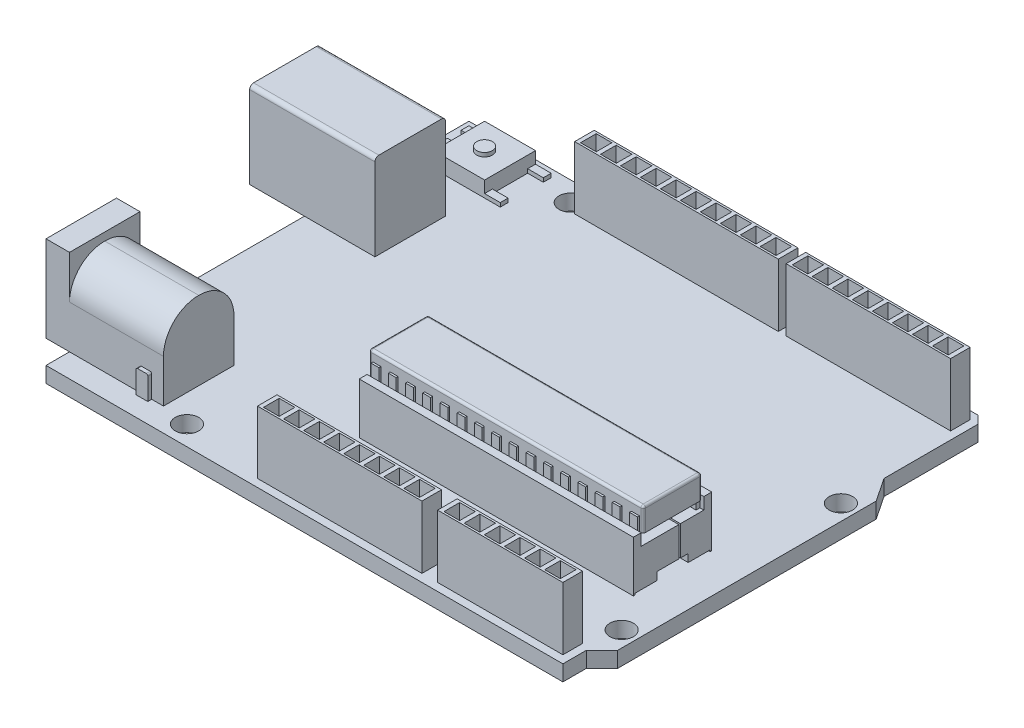
from build123d import *

# Parameters (mm, degrees)
IZIM2_R                           = 1.5
Y_KSEKLIK_EKSTR_ZYON1_DEPTH       = 2
IZIM3_W                           = 6.5
IZIM3_H                           = 6.5
Y_KSEKLIK_EKSTR_ZYON2_DEPTH       = 2
IZIM4_R                           = 1
Y_KSEKLIK_EKSTR_ZYON3_DEPTH       = 0.5
IZIM5_W                           = 2
IZIM5_H                           = 1
Y_KSEKLIK_EKSTR_ZYON4_DEPTH       = 0.5
IZIM6_W                           = 16
IZIM6_H                           = 9
Y_KSEKLIK_EKSTR_ZYON5_DEPTH       = 11
KES_EKSTR_ZYON1_DEPTH             = 11
IZIM8_W                           = 5.5
IZIM8_H                           = 3
Y_KSEKLIK_EKSTR_ZYON6_DEPTH       = 11
RADYUS1_R                         = 0.5
RADYUS2_R                         = 0.5
IZIM9_W                           = 12
IZIM9_H                           = 9
Y_KSEKLIK_EKSTR_ZYON7_DEPTH       = 10
RADYUS3_R                         = 4.5
RADYUS4_R                         = 4.5
IZIM10_W                          = 9
IZIM10_H                          = 11
Y_KSEKLIK_EKSTR_ZYON8_DEPTH       = 3
IZIM11_R                          = 3
KES_EKSTR_ZYON2_DEPTH             = 8
IZIM12_R                          = 0.5
Y_KSEKLIK_EKSTR_ZYON9_DEPTH       = 7
IZIM13_W                          = 1.5
IZIM13_H                          = 3
Y_KSEKLIK_EKSTR_ZYON10_DEPTH      = 0.5
RADYUS5_R                         = 0.2
RADYUS6_R                         = 0.2
IZIM15_W                          = 1.5
IZIM15_H                          = 3
Y_KSEKLIK_EKSTR_ZYON11_DEPTH      = 0.5
RADYUS7_R                         = 0.2
RADYUS8_R                         = 0.2
RADYUS9_R                         = 0.3
IZIM16_W                          = 35
IZIM16_H                          = 10
Y_KSEKLIK_EKSTR_ZYON12_DEPTH      = 5
IZIM17_W                          = 35
IZIM17_H                          = 1
Y_KSEKLIK_EKSTR_ZYON13_DEPTH      = 1.5
IZIM18_W                          = 1
IZIM18_H                          = 0.5
Y_KSEKLIK_EKSTR_ZYON14_DEPTH      = 3
Y_KSEKLIK_EKSTR_ZYON15_DEPTH      = 2.5
Y_KSEKLIK_EKSTR_ZYON15_DEPTH_BACK = 0.5
IZIM19_W                          = 35
IZIM19_H                          = 7.5
RADYUS10_R                        = 0.3
RADYUS11_R                        = 0.3
RADYUS12_R                        = 0.3
RADYUS13_R                        = 0.3
KES_EKSTR_ZYON3_REACH             = 78.145
IZIM21_W                          = 16
IZIM21_H                          = 2.5
IZIM21_W_2                        = 2
IZIM21_H_2                        = 2
IZIM21_W_3                        = 21
Y_KSEKLIK_EKSTR_ZYON16_DEPTH      = 8
IZIM22_W                          = 21
IZIM22_H                          = 2.5
IZIM22_W_2                        = 2
IZIM22_H_2                        = 2
IZIM22_W_3                        = 26
Y_KSEKLIK_EKSTR_ZYON17_DEPTH      = 8


with BuildPart() as part:
    # Çizim2 → Yükseklik-Ekstrüzyon1 (new body)
    with BuildSketch(Plane(origin=(0, 0, 0), x_dir=(1, 0, 0), z_dir=(0, 1, 0))):
        Polygon((-34, 27), (31, 27), (32, 26), (32, 14), (34, 11), (34, -22), (32, -24), (32, -27), (-34, -27), align=None)
        with Locations(Location((32, -19.5, 0), (0, 0, 270))):
            Circle(IZIM2_R, mode=Mode.SUBTRACT)
        with Locations(Location((32, 8.5, 0), (0, 0, 270))):
            Circle(IZIM2_R, mode=Mode.SUBTRACT)
        with Locations(Location((-18.5, 24.5, 0), (0, 0, 270))):
            Circle(IZIM2_R, mode=Mode.SUBTRACT)
        with Locations(Location((-18.5, -24.5, 0), (0, 0, 270))):
            Circle(IZIM2_R, mode=Mode.SUBTRACT)
    extrude(amount=Y_KSEKLIK_EKSTR_ZYON1_DEPTH)

    # Çizim3 → Yükseklik-Ekstrüzyon2 (add)
    with BuildSketch(Plane(origin=(0, 2, 0), x_dir=(1, 0, 0), z_dir=(0, 1, 0))):
        with Locations((-27.75, 22.75)):
            Rectangle(IZIM3_W, IZIM3_H)
    extrude(amount=Y_KSEKLIK_EKSTR_ZYON2_DEPTH)

    # Çizim4 → Yükseklik-Ekstrüzyon3 (add)
    with BuildSketch(Plane(origin=(0, 4, 0), x_dir=(1, 0, 0), z_dir=(0, 1, 0))):
        with Locations(Location((-27.75, 22.75, 0), (0, 0, 270))):
            Circle(IZIM4_R)
    extrude(amount=Y_KSEKLIK_EKSTR_ZYON3_DEPTH)

    # Çizim5 → Yükseklik-Ekstrüzyon4 (add)
    with BuildSketch(Plane(origin=(0, 2, 0), x_dir=(1, 0, 0), z_dir=(0, 1, 0))):
        with Locations((-32, 22.75)):
            Rectangle(IZIM5_W, IZIM5_H)
        with Locations((-32, 25.5)):
            Rectangle(IZIM5_W, IZIM5_H)
        with Locations((-32, 20)):
            Rectangle(IZIM5_W, IZIM5_H)
        with Locations((-23.5, 25.5)):
            Rectangle(IZIM5_W, IZIM5_H)
        with Locations((-23.5, 20)):
            Rectangle(IZIM5_W, IZIM5_H)
    extrude(amount=Y_KSEKLIK_EKSTR_ZYON4_DEPTH)

    # Çizim6 → Yükseklik-Ekstrüzyon5 (add)
    with BuildSketch(Plane(origin=(0, 2, 0), x_dir=(1, 0, 0), z_dir=(0, 1, 0))):
        with Locations((-33, 10.5)):
            Rectangle(IZIM6_W, IZIM6_H)
    extrude(amount=Y_KSEKLIK_EKSTR_ZYON5_DEPTH)

    # Çizim7 → Kes-Ekstrüzyon1 (cut)
    with BuildSketch(Plane.ZY.offset(41)):
        Polygon((-14, 3.5), (-7, 3.5), (-7, 10.5), (-8.5, 12), (-12.5, 12), (-14, 10.5), align=None)
    extrude(amount=-KES_EKSTR_ZYON1_DEPTH, mode=Mode.SUBTRACT)

    # Çizim8 → Yükseklik-Ekstrüzyon6 (add)
    with BuildSketch(Plane.ZY.offset(30)):
        with Locations((-10.5, 7)):
            Rectangle(IZIM8_W, IZIM8_H)
    extrude(amount=Y_KSEKLIK_EKSTR_ZYON6_DEPTH)

    # Radyus1
    radyus1_edges = [part.edges().sort_by_distance(p)[0] for p in [
        (-33, 13, -6),
    ]]
    fillet(radyus1_edges, radius=RADYUS1_R)

    # Radyus2
    radyus2_edges = [part.edges().sort_by_distance(p)[0] for p in [
        (-33, 13, -15),
    ]]
    fillet(radyus2_edges, radius=RADYUS2_R)

    # Çizim9 → Yükseklik-Ekstrüzyon7 (add)
    with BuildSketch(Plane(origin=(0, 2, 0), x_dir=(1, 0, 0), z_dir=(0, 1, 0))):
        with Locations((-28, -19.5)):
            Rectangle(IZIM9_W, IZIM9_H)
    extrude(amount=Y_KSEKLIK_EKSTR_ZYON7_DEPTH)

    # Radyus3
    radyus3_edges = [part.edges().sort_by_distance(p)[0] for p in [
        (-28, 12, 15),
    ]]
    fillet(radyus3_edges, radius=RADYUS3_R)

    # Radyus4
    radyus4_edges = [part.edges().sort_by_distance(p)[0] for p in [
        (-28, 12, 24),
    ]]
    fillet(radyus4_edges, radius=RADYUS4_R - 0.0001)  # a hair under: the kernel refuses the full size

    # Çizim10 → Yükseklik-Ekstrüzyon8 (add)
    with BuildSketch(Plane.ZY.offset(34)):
        with Locations((19.5, 7.5)):
            Rectangle(IZIM10_W, IZIM10_H)
    extrude(amount=Y_KSEKLIK_EKSTR_ZYON8_DEPTH)

    # Çizim11 → Kes-Ekstrüzyon2 (cut)
    with BuildSketch(Plane.ZY.offset(37)):
        with Locations((19.5, 8)):
            Circle(IZIM11_R)
    extrude(amount=-KES_EKSTR_ZYON2_DEPTH, mode=Mode.SUBTRACT)

    # Çizim12 → Yükseklik-Ekstrüzyon9 (add)
    with BuildSketch(Plane.ZY.offset(29)):
        with Locations((19.5, 8)):
            Circle(IZIM12_R)
    extrude(amount=Y_KSEKLIK_EKSTR_ZYON9_DEPTH)

    # Çizim13 → Yükseklik-Ekstrüzyon10 (add)
    with BuildSketch(Plane.XY.offset(24)):
        with Locations((-24.25, 3.5)):
            Rectangle(IZIM13_W, IZIM13_H)
    extrude(amount=Y_KSEKLIK_EKSTR_ZYON10_DEPTH)

    # Radyus5
    radyus5_edges = [part.edges().sort_by_distance(p)[0] for p in [
        (-23.5, 5, 24.25),
    ]]
    fillet(radyus5_edges, radius=RADYUS5_R)

    # Radyus6
    radyus6_edges = [part.edges().sort_by_distance(p)[0] for p in [
        (-25, 5, 24.25),
    ]]
    fillet(radyus6_edges, radius=RADYUS6_R)

    # Çizim15 → Yükseklik-Ekstrüzyon11 (add)
    with BuildSketch(Plane(origin=(0, 0, 15), x_dir=(-1, 0, 0), z_dir=(0, 0, -1))):
        with Locations((24.25, 3.5)):
            Rectangle(IZIM15_W, IZIM15_H)
    extrude(amount=Y_KSEKLIK_EKSTR_ZYON11_DEPTH)

    # Radyus7
    radyus7_edges = [part.edges().sort_by_distance(p)[0] for p in [
        (-23.5, 5, 14.75),
    ]]
    fillet(radyus7_edges, radius=RADYUS7_R)

    # Radyus8
    radyus8_edges = [part.edges().sort_by_distance(p)[0] for p in [
        (-25, 5, 14.75),
    ]]
    fillet(radyus8_edges, radius=RADYUS8_R)

    # Radyus9
    radyus9_edges = [part.edges().sort_by_distance(p)[0] for p in [
        (-36, 8, 19),
    ]]
    fillet(radyus9_edges, radius=RADYUS9_R)

    # Çizim16 → Yükseklik-Ekstrüzyon12 (add)
    with BuildSketch(Plane(origin=(0, 2, 0), x_dir=(1, 0, 0), z_dir=(0, 1, 0))):
        with Locations((11.5, -10)):
            Rectangle(IZIM16_W, IZIM16_H)
    extrude(amount=Y_KSEKLIK_EKSTR_ZYON12_DEPTH)

    # Çizim17 → Yükseklik-Ekstrüzyon13 (add)
    with BuildSketch(Plane(origin=(0, 7, 0), x_dir=(1, 0, 0), z_dir=(0, 1, 0))):
        with Locations((11.5, -5.5)):
            Rectangle(IZIM17_W, IZIM17_H)
        with Locations((11.5, -14.5)):
            Rectangle(IZIM17_W, IZIM17_H)
    extrude(amount=Y_KSEKLIK_EKSTR_ZYON13_DEPTH)

    # Çizim18 → Yükseklik-Ekstrüzyon14 (add)
    with BuildSketch(Plane(origin=(0, 7, 0), x_dir=(1, 0, 0), z_dir=(0, 1, 0))):
        with Locations((-5, -6.25)):
            Rectangle(IZIM18_W, IZIM18_H)
        with Locations((-2.8, -6.25)):
            Rectangle(IZIM18_W, IZIM18_H)
        with Locations((-0.6, -6.25)):
            Rectangle(IZIM18_W, IZIM18_H)
        with Locations((1.6, -6.25)):
            Rectangle(IZIM18_W, IZIM18_H)
        with Locations((3.8, -6.25)):
            Rectangle(IZIM18_W, IZIM18_H)
        with Locations((6, -6.25)):
            Rectangle(IZIM18_W, IZIM18_H)
        with Locations((8.2, -6.25)):
            Rectangle(IZIM18_W, IZIM18_H)
        with Locations((10.4, -6.25)):
            Rectangle(IZIM18_W, IZIM18_H)
        with Locations((12.6, -6.25)):
            Rectangle(IZIM18_W, IZIM18_H)
        with Locations((14.8, -6.25)):
            Rectangle(IZIM18_W, IZIM18_H)
        with Locations((17, -6.25)):
            Rectangle(IZIM18_W, IZIM18_H)
        with Locations((19.2, -6.25)):
            Rectangle(IZIM18_W, IZIM18_H)
        with Locations((21.4, -6.25)):
            Rectangle(IZIM18_W, IZIM18_H)
        with Locations((23.6, -6.25)):
            Rectangle(IZIM18_W, IZIM18_H)
        with Locations((25.8, -6.25)):
            Rectangle(IZIM18_W, IZIM18_H)
        with Locations((28, -6.25)):
            Rectangle(IZIM18_W, IZIM18_H)
        with Locations((28, -13.75)):
            Rectangle(IZIM18_W, IZIM18_H)
        with Locations((25.8, -13.75)):
            Rectangle(IZIM18_W, IZIM18_H)
        with Locations((23.6, -13.75)):
            Rectangle(IZIM18_W, IZIM18_H)
        with Locations((21.4, -13.75)):
            Rectangle(IZIM18_W, IZIM18_H)
        with Locations((19.2, -13.75)):
            Rectangle(IZIM18_W, IZIM18_H)
        with Locations((17, -13.75)):
            Rectangle(IZIM18_W, IZIM18_H)
        with Locations((14.8, -13.75)):
            Rectangle(IZIM18_W, IZIM18_H)
        with Locations((12.6, -13.75)):
            Rectangle(IZIM18_W, IZIM18_H)
        with Locations((10.4, -13.75)):
            Rectangle(IZIM18_W, IZIM18_H)
        with Locations((8.2, -13.75)):
            Rectangle(IZIM18_W, IZIM18_H)
        with Locations((6, -13.75)):
            Rectangle(IZIM18_W, IZIM18_H)
        with Locations((3.8, -13.75)):
            Rectangle(IZIM18_W, IZIM18_H)
        with Locations((1.6, -13.75)):
            Rectangle(IZIM18_W, IZIM18_H)
        with Locations((-0.6, -13.75)):
            Rectangle(IZIM18_W, IZIM18_H)
        with Locations((-2.8, -13.75)):
            Rectangle(IZIM18_W, IZIM18_H)
        with Locations((-5, -13.75)):
            Rectangle(IZIM18_W, IZIM18_H)
    extrude(amount=Y_KSEKLIK_EKSTR_ZYON14_DEPTH)

    # Çizim19 → Yükseklik-Ekstrüzyon15 (add, two sides: drawn at the far end of the back side and taken through both)
    with BuildSketch(Plane(origin=(0, 8.75, 0), x_dir=(1, 0, 0), z_dir=(0, 1, 0)).offset(-Y_KSEKLIK_EKSTR_ZYON15_DEPTH_BACK)):
        with Locations((11.5, -10)):
            Rectangle(IZIM19_W, IZIM19_H)
    extrude(amount=Y_KSEKLIK_EKSTR_ZYON15_DEPTH + Y_KSEKLIK_EKSTR_ZYON15_DEPTH_BACK)

    # Radyus10
    radyus10_edges = [part.edges().sort_by_distance(p)[0] for p in [
        (11.5, 11.25, 13.75),
    ]]
    fillet(radyus10_edges, radius=RADYUS10_R)

    # Radyus11
    radyus11_edges = [part.edges().sort_by_distance(p)[0] for p in [
        (11.5, 11.25, 6.25),
    ]]
    fillet(radyus11_edges, radius=RADYUS11_R)

    # Radyus12
    radyus12_edges = [part.edges().sort_by_distance(p)[0] for p in [
        (29, 9.6, 13.75),
        (29, 9.6, 6.25),
        (29, 11.25, 10),
        (29, 11.162132034, 13.662132034),
        (29, 11.162132034, 6.337867966),
    ]]
    fillet(radyus12_edges, radius=RADYUS12_R)

    # Radyus13
    radyus13_edges = [part.edges().sort_by_distance(p)[0] for p in [
        (-6, 9.6, 13.75),
        (-6, 11.162132034, 13.662132034),
        (-6, 11.25, 10),
        (-6, 11.162132034, 6.337867966),
        (-6, 9.6, 6.25),
    ]]
    fillet(radyus13_edges, radius=RADYUS13_R)

    # Çizim20 → Kes-Ekstrüzyon3 (cut, up to next)
    with BuildSketch(Plane(origin=(29, 0, 0), x_dir=(0, 0, -1), z_dir=(1, 0, 0)), mode=Mode.PRIVATE) as kes_ekstr_zyon3_sk1:
        Polygon((-14.8, 2), (-5.2, 2), (-5.2, 2.2), (-8, 2.2), (-8, 3.2), (-9, 3.2), (-9, 7), (-9.2, 7), (-9.2, 3.2), (-12, 3.2), (-12, 2.2), (-14.8, 2.2), align=None)
    kes_ekstr_zyon3_tool1 = extrude(kes_ekstr_zyon3_sk1.sketch, amount=-KES_EKSTR_ZYON3_REACH, mode=Mode.PRIVATE) & part.part
    add(kes_ekstr_zyon3_tool1.solids().sort_by_distance((29, 2.800599, 9.897605))[0], mode=Mode.SUBTRACT)

    # Çizim21 → Yükseklik-Ekstrüzyon16 (add)
    # profile 1 of 2: a face of its own
    with BuildSketch(Plane(origin=(0, 2, 0), x_dir=(1, 0, 0), z_dir=(0, 1, 0))):
        with Locations((23, -24.75)):
            Rectangle(IZIM21_W, IZIM21_H)
        with Locations((19.141428571, -24.75)):
            Rectangle(IZIM21_W_2, IZIM21_H_2, mode=Mode.SUBTRACT)
        with Locations((16.571428571, -24.75)):
            Rectangle(IZIM21_W_2, IZIM21_H_2, mode=Mode.SUBTRACT)
        with Locations((21.711428571, -24.75)):
            Rectangle(IZIM21_W_2, IZIM21_H_2, mode=Mode.SUBTRACT)
        with Locations((24.281428571, -24.75)):
            Rectangle(IZIM21_W_2, IZIM21_H_2, mode=Mode.SUBTRACT)
        with Locations((26.851428571, -24.75)):
            Rectangle(IZIM21_W_2, IZIM21_H_2, mode=Mode.SUBTRACT)
        with Locations((29.421428571, -24.75)):
            Rectangle(IZIM21_W_2, IZIM21_H_2, mode=Mode.SUBTRACT)
    # profile 2 of 2: a face of its own
    with BuildSketch(Plane(origin=(0, 2, 0), x_dir=(1, 0, 0), z_dir=(0, 1, 0))):
        with Locations((2.5, -24.75)):
            Rectangle(IZIM21_W_3, IZIM21_H)
        with Locations((8.884444444, -24.75)):
            Rectangle(IZIM21_W_2, IZIM21_H_2, mode=Mode.SUBTRACT)
        with Locations((11.444444444, -24.75)):
            Rectangle(IZIM21_W_2, IZIM21_H_2, mode=Mode.SUBTRACT)
        with Locations((6.324444444, -24.75)):
            Rectangle(IZIM21_W_2, IZIM21_H_2, mode=Mode.SUBTRACT)
        with Locations((3.764444444, -24.75)):
            Rectangle(IZIM21_W_2, IZIM21_H_2, mode=Mode.SUBTRACT)
        with Locations((1.204444444, -24.75)):
            Rectangle(IZIM21_W_2, IZIM21_H_2, mode=Mode.SUBTRACT)
        with Locations((-1.355555556, -24.75)):
            Rectangle(IZIM21_W_2, IZIM21_H_2, mode=Mode.SUBTRACT)
        with Locations((-3.915555556, -24.75)):
            Rectangle(IZIM21_W_2, IZIM21_H_2, mode=Mode.SUBTRACT)
        with Locations((-6.475555556, -24.75)):
            Rectangle(IZIM21_W_2, IZIM21_H_2, mode=Mode.SUBTRACT)
    extrude(amount=Y_KSEKLIK_EKSTR_ZYON16_DEPTH)

    # Çizim22 → Yükseklik-Ekstrüzyon17 (add)
    # profile 1 of 2: a face of its own
    with BuildSketch(Plane(origin=(0, 2, 0), x_dir=(1, 0, 0), z_dir=(0, 1, 0))):
        with Locations((20.5, 24.75)):
            Rectangle(IZIM22_W, IZIM22_H)
        with Locations((26.884444444, 24.75)):
            Rectangle(IZIM22_W_2, IZIM22_H_2, mode=Mode.SUBTRACT)
        with Locations((29.444444444, 24.75)):
            Rectangle(IZIM22_W_2, IZIM22_H_2, mode=Mode.SUBTRACT)
        with Locations((24.324444444, 24.75)):
            Rectangle(IZIM22_W_2, IZIM22_H_2, mode=Mode.SUBTRACT)
        with Locations((21.764444444, 24.75)):
            Rectangle(IZIM22_W_2, IZIM22_H_2, mode=Mode.SUBTRACT)
        with Locations((19.204444444, 24.75)):
            Rectangle(IZIM22_W_2, IZIM22_H_2, mode=Mode.SUBTRACT)
        with Locations((16.644444444, 24.75)):
            Rectangle(IZIM22_W_2, IZIM22_H_2, mode=Mode.SUBTRACT)
        with Locations((14.084444444, 24.75)):
            Rectangle(IZIM22_W_2, IZIM22_H_2, mode=Mode.SUBTRACT)
        with Locations((11.524444444, 24.75)):
            Rectangle(IZIM22_W_2, IZIM22_H_2, mode=Mode.SUBTRACT)
    # profile 2 of 2: a face of its own
    with BuildSketch(Plane(origin=(0, 2, 0), x_dir=(1, 0, 0), z_dir=(0, 1, 0))):
        with Locations((-4, 24.75)):
            Rectangle(IZIM22_W_3, IZIM22_H)
        with Locations((4.904545455, 24.75)):
            Rectangle(IZIM22_W_2, IZIM22_H_2, mode=Mode.SUBTRACT)
        with Locations((7.454545455, 24.75)):
            Rectangle(IZIM22_W_2, IZIM22_H_2, mode=Mode.SUBTRACT)
        with Locations((2.354545455, 24.75)):
            Rectangle(IZIM22_W_2, IZIM22_H_2, mode=Mode.SUBTRACT)
        with Locations((-0.195454545, 24.75)):
            Rectangle(IZIM22_W_2, IZIM22_H_2, mode=Mode.SUBTRACT)
        with Locations((-2.745454545, 24.75)):
            Rectangle(IZIM22_W_2, IZIM22_H_2, mode=Mode.SUBTRACT)
        with Locations((-5.295454545, 24.75)):
            Rectangle(IZIM22_W_2, IZIM22_H_2, mode=Mode.SUBTRACT)
        with Locations((-7.845454545, 24.75)):
            Rectangle(IZIM22_W_2, IZIM22_H_2, mode=Mode.SUBTRACT)
        with Locations((-10.395454545, 24.75)):
            Rectangle(IZIM22_W_2, IZIM22_H_2, mode=Mode.SUBTRACT)
        with Locations((-12.945454545, 24.75)):
            Rectangle(IZIM22_W_2, IZIM22_H_2, mode=Mode.SUBTRACT)
        with Locations((-15.495454545, 24.75)):
            Rectangle(IZIM22_W_2, IZIM22_H_2, mode=Mode.SUBTRACT)
    extrude(amount=Y_KSEKLIK_EKSTR_ZYON17_DEPTH)


solid = part.part
